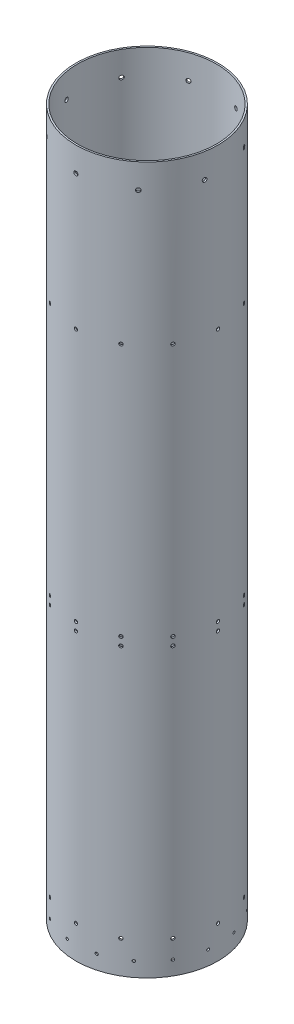
from build123d import *

# Parameters (mm, degrees)
SZKIC1_R                       = 87
SZKIC1_R_2                     = 85
DODANIE_WYCI_GNI_CIE2_DEPTH    = 865
WYTNIJ_WYCI_GNI_CIE1_REACH     = 888.606
SZKIC3_R                       = 2
SZYK_KO_OWY1_COUNT             = 12
SZYK_LINIOWY1_COPY_1_REACH     = 888.606
SZYK_LINIOWY1_COPY_1_SKETCH_R  = 2
SZYK_LINIOWY1_COPY_2_REACH     = 888.606
SZYK_LINIOWY1_COPY_2_SKETCH_R  = 2
SZYK_LINIOWY1_COPY_3_REACH     = 888.606
SZYK_LINIOWY1_COPY_3_SKETCH_R  = 2
SZYK_LINIOWY1_COPY_4_REACH     = 888.606
SZYK_LINIOWY1_COPY_4_SKETCH_R  = 2
SZYK_LINIOWY1_COPY_5_REACH     = 888.606
SZYK_LINIOWY1_COPY_5_SKETCH_R  = 2
SZYK_LINIOWY1_COPY_6_REACH     = 888.606
SZYK_LINIOWY1_COPY_6_SKETCH_R  = 2
SZYK_LINIOWY1_COPY_7_REACH     = 888.606
SZYK_LINIOWY1_COPY_7_SKETCH_R  = 2
SZYK_LINIOWY1_COPY_8_REACH     = 888.606
SZYK_LINIOWY1_COPY_8_SKETCH_R  = 2
SZYK_LINIOWY1_COPY_9_REACH     = 888.606
SZYK_LINIOWY1_COPY_9_SKETCH_R  = 2
SZYK_LINIOWY1_COPY_10_REACH    = 888.606
SZYK_LINIOWY1_COPY_10_SKETCH_R = 2
SZYK_LINIOWY1_COPY_11_REACH    = 888.606
SZYK_LINIOWY1_COPY_11_SKETCH_R = 2
SZYK_LINIOWY1_COPY_12_REACH    = 888.606
SZYK_LINIOWY1_COPY_12_SKETCH_R = 2
SZYK_LINIOWY2_COPY_1_REACH     = 888.606
SZYK_LINIOWY2_COPY_1_SKETCH_R  = 2
SZYK_LINIOWY2_COPY_2_REACH     = 888.606
SZYK_LINIOWY2_COPY_2_SKETCH_R  = 2
SZYK_LINIOWY2_COPY_3_REACH     = 888.606
SZYK_LINIOWY2_COPY_3_SKETCH_R  = 2
SZYK_LINIOWY2_COPY_4_REACH     = 888.606
SZYK_LINIOWY2_COPY_4_SKETCH_R  = 2
SZYK_LINIOWY2_COPY_5_REACH     = 888.606
SZYK_LINIOWY2_COPY_5_SKETCH_R  = 2
SZYK_LINIOWY2_COPY_6_REACH     = 888.606
SZYK_LINIOWY2_COPY_6_SKETCH_R  = 2
SZYK_LINIOWY2_COPY_7_REACH     = 888.606
SZYK_LINIOWY2_COPY_7_SKETCH_R  = 2
SZYK_LINIOWY2_COPY_8_REACH     = 888.606
SZYK_LINIOWY2_COPY_8_SKETCH_R  = 2
SZYK_LINIOWY2_COPY_9_REACH     = 888.606
SZYK_LINIOWY2_COPY_9_SKETCH_R  = 2
SZYK_LINIOWY2_COPY_10_REACH    = 888.606
SZYK_LINIOWY2_COPY_10_SKETCH_R = 2
SZYK_LINIOWY2_COPY_11_REACH    = 888.606
SZYK_LINIOWY2_COPY_11_SKETCH_R = 2
SZYK_LINIOWY2_COPY_12_REACH    = 888.606
SZYK_LINIOWY2_COPY_12_SKETCH_R = 2
SZYK_LINIOWY4_COPY_1_REACH     = 888.606
SZYK_LINIOWY4_COPY_1_SKETCH_R  = 2
SZYK_LINIOWY4_COPY_2_REACH     = 888.606
SZYK_LINIOWY4_COPY_2_SKETCH_R  = 2
SZYK_LINIOWY4_COPY_3_REACH     = 888.606
SZYK_LINIOWY4_COPY_3_SKETCH_R  = 2
SZYK_LINIOWY4_COPY_4_REACH     = 888.606
SZYK_LINIOWY4_COPY_4_SKETCH_R  = 2
SZYK_LINIOWY4_COPY_5_REACH     = 888.606
SZYK_LINIOWY4_COPY_5_SKETCH_R  = 2
SZYK_LINIOWY4_COPY_6_REACH     = 888.606
SZYK_LINIOWY4_COPY_6_SKETCH_R  = 2
SZYK_LINIOWY4_COPY_7_REACH     = 888.606
SZYK_LINIOWY4_COPY_7_SKETCH_R  = 2
SZYK_LINIOWY4_COPY_8_REACH     = 888.606
SZYK_LINIOWY4_COPY_8_SKETCH_R  = 2
SZYK_LINIOWY4_COPY_9_REACH     = 888.606
SZYK_LINIOWY4_COPY_9_SKETCH_R  = 2
SZYK_LINIOWY4_COPY_10_REACH    = 888.606
SZYK_LINIOWY4_COPY_10_SKETCH_R = 2
SZYK_LINIOWY4_COPY_11_REACH    = 888.606
SZYK_LINIOWY4_COPY_11_SKETCH_R = 2
SZYK_LINIOWY4_COPY_12_REACH    = 888.606
SZYK_LINIOWY4_COPY_12_SKETCH_R = 2
SZKIC8_R                       = 2.5
WYTNIJ_WYCI_GNI_CIE6_DEPTH     = 10
SZYK_KO_OWY5_COUNT             = 9
SZKIC11_R                      = 1.6
WYTNIJ_WYCI_GNI_CIE7_DEPTH     = 10
SZYK_KO_OWY6_COUNT             = 16


with BuildPart() as part:
    # Szkic1 → Dodanie-wyciągnięcie2 (new body)
    with BuildSketch(Plane(origin=(0, 0, 0), x_dir=(1, 0, 0), z_dir=(0, 1, 0))):
        Circle(SZKIC1_R)
        Circle(SZKIC1_R_2, mode=Mode.SUBTRACT)
    extrude(amount=DODANIE_WYCI_GNI_CIE2_DEPTH)

    # Szkic3 → Wytnij-wyciągnięcie1 (cut, up to next)
    with BuildSketch(Plane.XY.offset(87), mode=Mode.PRIVATE) as wytnij_wyci_gni_cie1_sk1:
        with Locations((0, 40)):
            Circle(SZKIC3_R)
    wytnij_wyci_gni_cie1_tool1 = extrude(wytnij_wyci_gni_cie1_sk1.sketch, amount=-WYTNIJ_WYCI_GNI_CIE1_REACH, mode=Mode.PRIVATE) & part.part
    wytnij_wyci_gni_cie1 = wytnij_wyci_gni_cie1_tool1.solids().sort_by_distance((0, 40, 87))[0]
    add(wytnij_wyci_gni_cie1, mode=Mode.SUBTRACT)

    # Szyk kołowy1: Wytnij-wyciągnięcie1 ×12 about axis
    szyk_ko_owy1_axis = Axis((0, 865, 0), (0, -1, 0))
    for i in range(1, SZYK_KO_OWY1_COUNT):
        add(wytnij_wyci_gni_cie1.rotate(szyk_ko_owy1_axis, i * 360 / SZYK_KO_OWY1_COUNT), mode=Mode.SUBTRACT)

    # Szyk liniowy1 copy 1 sketch → Szyk liniowy1 copy 1 (cut, up to next)
    with BuildSketch(Plane(origin=(-43.5, 310, 75.344210129), x_dir=(0.8660254037844387, 0, 0.49999999999999994), z_dir=(-0.49999999999999994, 0, 0.8660254037844387)), mode=Mode.PRIVATE) as szyk_liniowy1_copy_1_sk1:
        with Locations((0, 40)):
            Circle(SZYK_LINIOWY1_COPY_1_SKETCH_R)
    szyk_liniowy1_copy_1_tool1 = extrude(szyk_liniowy1_copy_1_sk1.sketch, amount=-SZYK_LINIOWY1_COPY_1_REACH, mode=Mode.PRIVATE) & part.part
    add(szyk_liniowy1_copy_1_tool1.solids().sort_by_distance((-43.5, 350, 75.344210129))[0], mode=Mode.SUBTRACT)

    # Szyk liniowy1 copy 2 sketch → Szyk liniowy1 copy 2 (cut, up to next)
    with BuildSketch(Plane(origin=(-75.344210129, 310, 43.5), x_dir=(0.5000000000000001, 0, 0.8660254037844386), z_dir=(-0.8660254037844386, 0, 0.5000000000000001)), mode=Mode.PRIVATE) as szyk_liniowy1_copy_2_sk1:
        with Locations((0, 40)):
            Circle(SZYK_LINIOWY1_COPY_2_SKETCH_R)
    szyk_liniowy1_copy_2_tool1 = extrude(szyk_liniowy1_copy_2_sk1.sketch, amount=-SZYK_LINIOWY1_COPY_2_REACH, mode=Mode.PRIVATE) & part.part
    add(szyk_liniowy1_copy_2_tool1.solids().sort_by_distance((-75.344210129, 350, 43.5))[0], mode=Mode.SUBTRACT)

    # Szyk liniowy1 copy 3 sketch → Szyk liniowy1 copy 3 (cut, up to next)
    with BuildSketch(Plane(origin=(-87, 310, 0), x_dir=(0, 0, 1), z_dir=(-1, 0, 0)), mode=Mode.PRIVATE) as szyk_liniowy1_copy_3_sk1:
        with Locations((0, 40)):
            Circle(SZYK_LINIOWY1_COPY_3_SKETCH_R)
    szyk_liniowy1_copy_3_tool1 = extrude(szyk_liniowy1_copy_3_sk1.sketch, amount=-SZYK_LINIOWY1_COPY_3_REACH, mode=Mode.PRIVATE) & part.part
    add(szyk_liniowy1_copy_3_tool1.solids().sort_by_distance((-87, 350, 0))[0], mode=Mode.SUBTRACT)

    # Szyk liniowy1 copy 4 sketch → Szyk liniowy1 copy 4 (cut, up to next)
    with BuildSketch(Plane(origin=(-75.344210129, 310, -43.5), x_dir=(-0.4999999999999998, 0, 0.8660254037844387), z_dir=(-0.8660254037844387, 0, -0.4999999999999998)), mode=Mode.PRIVATE) as szyk_liniowy1_copy_4_sk1:
        with Locations((0, 40)):
            Circle(SZYK_LINIOWY1_COPY_4_SKETCH_R)
    szyk_liniowy1_copy_4_tool1 = extrude(szyk_liniowy1_copy_4_sk1.sketch, amount=-SZYK_LINIOWY1_COPY_4_REACH, mode=Mode.PRIVATE) & part.part
    add(szyk_liniowy1_copy_4_tool1.solids().sort_by_distance((-75.344210129, 350, -43.5))[0], mode=Mode.SUBTRACT)

    # Szyk liniowy1 copy 5 sketch → Szyk liniowy1 copy 5 (cut, up to next)
    with BuildSketch(Plane(origin=(-43.5, 310, -75.344210129), x_dir=(-0.8660254037844387, 0, 0.49999999999999994), z_dir=(-0.49999999999999994, 0, -0.8660254037844387)), mode=Mode.PRIVATE) as szyk_liniowy1_copy_5_sk1:
        with Locations((0, 40)):
            Circle(SZYK_LINIOWY1_COPY_5_SKETCH_R)
    szyk_liniowy1_copy_5_tool1 = extrude(szyk_liniowy1_copy_5_sk1.sketch, amount=-SZYK_LINIOWY1_COPY_5_REACH, mode=Mode.PRIVATE) & part.part
    add(szyk_liniowy1_copy_5_tool1.solids().sort_by_distance((-43.5, 350, -75.344210129))[0], mode=Mode.SUBTRACT)

    # Szyk liniowy1 copy 6 sketch → Szyk liniowy1 copy 6 (cut, up to next)
    with BuildSketch(Plane(origin=(0, 310, -87), x_dir=(-1, 0, 0), z_dir=(0, 0, -1)), mode=Mode.PRIVATE) as szyk_liniowy1_copy_6_sk1:
        with Locations((0, 40)):
            Circle(SZYK_LINIOWY1_COPY_6_SKETCH_R)
    szyk_liniowy1_copy_6_tool1 = extrude(szyk_liniowy1_copy_6_sk1.sketch, amount=-SZYK_LINIOWY1_COPY_6_REACH, mode=Mode.PRIVATE) & part.part
    add(szyk_liniowy1_copy_6_tool1.solids().sort_by_distance((0, 350, -87))[0], mode=Mode.SUBTRACT)

    # Szyk liniowy1 copy 7 sketch → Szyk liniowy1 copy 7 (cut, up to next)
    with BuildSketch(Plane(origin=(43.5, 310, -75.344210129), x_dir=(-0.8660254037844386, 0, -0.5000000000000001), z_dir=(0.5000000000000001, 0, -0.8660254037844386)), mode=Mode.PRIVATE) as szyk_liniowy1_copy_7_sk1:
        with Locations((0, 40)):
            Circle(SZYK_LINIOWY1_COPY_7_SKETCH_R)
    szyk_liniowy1_copy_7_tool1 = extrude(szyk_liniowy1_copy_7_sk1.sketch, amount=-SZYK_LINIOWY1_COPY_7_REACH, mode=Mode.PRIVATE) & part.part
    add(szyk_liniowy1_copy_7_tool1.solids().sort_by_distance((43.5, 350, -75.344210129))[0], mode=Mode.SUBTRACT)

    # Szyk liniowy1 copy 8 sketch → Szyk liniowy1 copy 8 (cut, up to next)
    with BuildSketch(Plane(origin=(75.344210129, 310, -43.5), x_dir=(-0.5000000000000004, 0, -0.8660254037844384), z_dir=(0.8660254037844384, 0, -0.5000000000000004)), mode=Mode.PRIVATE) as szyk_liniowy1_copy_8_sk1:
        with Locations((0, 40)):
            Circle(SZYK_LINIOWY1_COPY_8_SKETCH_R)
    szyk_liniowy1_copy_8_tool1 = extrude(szyk_liniowy1_copy_8_sk1.sketch, amount=-SZYK_LINIOWY1_COPY_8_REACH, mode=Mode.PRIVATE) & part.part
    add(szyk_liniowy1_copy_8_tool1.solids().sort_by_distance((75.344210129, 350, -43.5))[0], mode=Mode.SUBTRACT)

    # Szyk liniowy1 copy 9 sketch → Szyk liniowy1 copy 9 (cut, up to next)
    with BuildSketch(Plane(origin=(87, 310, 0), x_dir=(0, 0, -1), z_dir=(1, 0, 0)), mode=Mode.PRIVATE) as szyk_liniowy1_copy_9_sk1:
        with Locations((0, 40)):
            Circle(SZYK_LINIOWY1_COPY_9_SKETCH_R)
    szyk_liniowy1_copy_9_tool1 = extrude(szyk_liniowy1_copy_9_sk1.sketch, amount=-SZYK_LINIOWY1_COPY_9_REACH, mode=Mode.PRIVATE) & part.part
    add(szyk_liniowy1_copy_9_tool1.solids().sort_by_distance((87, 350, 0))[0], mode=Mode.SUBTRACT)

    # Szyk liniowy1 copy 10 sketch → Szyk liniowy1 copy 10 (cut, up to next)
    with BuildSketch(Plane(origin=(75.344210129, 310, 43.5), x_dir=(0.5000000000000001, 0, -0.8660254037844386), z_dir=(0.8660254037844386, 0, 0.5000000000000001)), mode=Mode.PRIVATE) as szyk_liniowy1_copy_10_sk1:
        with Locations((0, 40)):
            Circle(SZYK_LINIOWY1_COPY_10_SKETCH_R)
    szyk_liniowy1_copy_10_tool1 = extrude(szyk_liniowy1_copy_10_sk1.sketch, amount=-SZYK_LINIOWY1_COPY_10_REACH, mode=Mode.PRIVATE) & part.part
    add(szyk_liniowy1_copy_10_tool1.solids().sort_by_distance((75.344210129, 350, 43.5))[0], mode=Mode.SUBTRACT)

    # Szyk liniowy1 copy 11 sketch → Szyk liniowy1 copy 11 (cut, up to next)
    with BuildSketch(Plane(origin=(43.5, 310, 75.344210129), x_dir=(0.8660254037844384, 0, -0.5000000000000004), z_dir=(0.5000000000000004, 0, 0.8660254037844384)), mode=Mode.PRIVATE) as szyk_liniowy1_copy_11_sk1:
        with Locations((0, 40)):
            Circle(SZYK_LINIOWY1_COPY_11_SKETCH_R)
    szyk_liniowy1_copy_11_tool1 = extrude(szyk_liniowy1_copy_11_sk1.sketch, amount=-SZYK_LINIOWY1_COPY_11_REACH, mode=Mode.PRIVATE) & part.part
    add(szyk_liniowy1_copy_11_tool1.solids().sort_by_distance((43.5, 350, 75.344210129))[0], mode=Mode.SUBTRACT)

    # Szyk liniowy1 copy 12 sketch → Szyk liniowy1 copy 12 (cut, up to next)
    with BuildSketch(Plane(origin=(0, 310, 87), x_dir=(1, 0, 0), z_dir=(0, 0, 1)), mode=Mode.PRIVATE) as szyk_liniowy1_copy_12_sk1:
        with Locations((0, 40)):
            Circle(SZYK_LINIOWY1_COPY_12_SKETCH_R)
    szyk_liniowy1_copy_12_tool1 = extrude(szyk_liniowy1_copy_12_sk1.sketch, amount=-SZYK_LINIOWY1_COPY_12_REACH, mode=Mode.PRIVATE) & part.part
    add(szyk_liniowy1_copy_12_tool1.solids().sort_by_distance((0, 350, 87))[0], mode=Mode.SUBTRACT)

    # Szyk liniowy2 copy 1 sketch → Szyk liniowy2 copy 1 (cut, up to next)
    with BuildSketch(Plane(origin=(-43.5, 320, 75.344210129), x_dir=(0.8660254037844387, 0, 0.49999999999999994), z_dir=(-0.49999999999999994, 0, 0.8660254037844387)), mode=Mode.PRIVATE) as szyk_liniowy2_copy_1_sk1:
        with Locations((0, 40)):
            Circle(SZYK_LINIOWY2_COPY_1_SKETCH_R)
    szyk_liniowy2_copy_1_tool1 = extrude(szyk_liniowy2_copy_1_sk1.sketch, amount=-SZYK_LINIOWY2_COPY_1_REACH, mode=Mode.PRIVATE) & part.part
    add(szyk_liniowy2_copy_1_tool1.solids().sort_by_distance((-43.5, 360, 75.344210129))[0], mode=Mode.SUBTRACT)

    # Szyk liniowy2 copy 2 sketch → Szyk liniowy2 copy 2 (cut, up to next)
    with BuildSketch(Plane(origin=(-75.344210129, 320, 43.5), x_dir=(0.5000000000000001, 0, 0.8660254037844386), z_dir=(-0.8660254037844386, 0, 0.5000000000000001)), mode=Mode.PRIVATE) as szyk_liniowy2_copy_2_sk1:
        with Locations((0, 40)):
            Circle(SZYK_LINIOWY2_COPY_2_SKETCH_R)
    szyk_liniowy2_copy_2_tool1 = extrude(szyk_liniowy2_copy_2_sk1.sketch, amount=-SZYK_LINIOWY2_COPY_2_REACH, mode=Mode.PRIVATE) & part.part
    add(szyk_liniowy2_copy_2_tool1.solids().sort_by_distance((-75.344210129, 360, 43.5))[0], mode=Mode.SUBTRACT)

    # Szyk liniowy2 copy 3 sketch → Szyk liniowy2 copy 3 (cut, up to next)
    with BuildSketch(Plane(origin=(-87, 320, 0), x_dir=(0, 0, 1), z_dir=(-1, 0, 0)), mode=Mode.PRIVATE) as szyk_liniowy2_copy_3_sk1:
        with Locations((0, 40)):
            Circle(SZYK_LINIOWY2_COPY_3_SKETCH_R)
    szyk_liniowy2_copy_3_tool1 = extrude(szyk_liniowy2_copy_3_sk1.sketch, amount=-SZYK_LINIOWY2_COPY_3_REACH, mode=Mode.PRIVATE) & part.part
    add(szyk_liniowy2_copy_3_tool1.solids().sort_by_distance((-87, 360, 0))[0], mode=Mode.SUBTRACT)

    # Szyk liniowy2 copy 4 sketch → Szyk liniowy2 copy 4 (cut, up to next)
    with BuildSketch(Plane(origin=(-75.344210129, 320, -43.5), x_dir=(-0.4999999999999998, 0, 0.8660254037844387), z_dir=(-0.8660254037844387, 0, -0.4999999999999998)), mode=Mode.PRIVATE) as szyk_liniowy2_copy_4_sk1:
        with Locations((0, 40)):
            Circle(SZYK_LINIOWY2_COPY_4_SKETCH_R)
    szyk_liniowy2_copy_4_tool1 = extrude(szyk_liniowy2_copy_4_sk1.sketch, amount=-SZYK_LINIOWY2_COPY_4_REACH, mode=Mode.PRIVATE) & part.part
    add(szyk_liniowy2_copy_4_tool1.solids().sort_by_distance((-75.344210129, 360, -43.5))[0], mode=Mode.SUBTRACT)

    # Szyk liniowy2 copy 5 sketch → Szyk liniowy2 copy 5 (cut, up to next)
    with BuildSketch(Plane(origin=(-43.5, 320, -75.344210129), x_dir=(-0.8660254037844387, 0, 0.49999999999999994), z_dir=(-0.49999999999999994, 0, -0.8660254037844387)), mode=Mode.PRIVATE) as szyk_liniowy2_copy_5_sk1:
        with Locations((0, 40)):
            Circle(SZYK_LINIOWY2_COPY_5_SKETCH_R)
    szyk_liniowy2_copy_5_tool1 = extrude(szyk_liniowy2_copy_5_sk1.sketch, amount=-SZYK_LINIOWY2_COPY_5_REACH, mode=Mode.PRIVATE) & part.part
    add(szyk_liniowy2_copy_5_tool1.solids().sort_by_distance((-43.5, 360, -75.344210129))[0], mode=Mode.SUBTRACT)

    # Szyk liniowy2 copy 6 sketch → Szyk liniowy2 copy 6 (cut, up to next)
    with BuildSketch(Plane(origin=(0, 320, -87), x_dir=(-1, 0, 0), z_dir=(0, 0, -1)), mode=Mode.PRIVATE) as szyk_liniowy2_copy_6_sk1:
        with Locations((0, 40)):
            Circle(SZYK_LINIOWY2_COPY_6_SKETCH_R)
    szyk_liniowy2_copy_6_tool1 = extrude(szyk_liniowy2_copy_6_sk1.sketch, amount=-SZYK_LINIOWY2_COPY_6_REACH, mode=Mode.PRIVATE) & part.part
    add(szyk_liniowy2_copy_6_tool1.solids().sort_by_distance((0, 360, -87))[0], mode=Mode.SUBTRACT)

    # Szyk liniowy2 copy 7 sketch → Szyk liniowy2 copy 7 (cut, up to next)
    with BuildSketch(Plane(origin=(43.5, 320, -75.344210129), x_dir=(-0.8660254037844386, 0, -0.5000000000000001), z_dir=(0.5000000000000001, 0, -0.8660254037844386)), mode=Mode.PRIVATE) as szyk_liniowy2_copy_7_sk1:
        with Locations((0, 40)):
            Circle(SZYK_LINIOWY2_COPY_7_SKETCH_R)
    szyk_liniowy2_copy_7_tool1 = extrude(szyk_liniowy2_copy_7_sk1.sketch, amount=-SZYK_LINIOWY2_COPY_7_REACH, mode=Mode.PRIVATE) & part.part
    add(szyk_liniowy2_copy_7_tool1.solids().sort_by_distance((43.5, 360, -75.344210129))[0], mode=Mode.SUBTRACT)

    # Szyk liniowy2 copy 8 sketch → Szyk liniowy2 copy 8 (cut, up to next)
    with BuildSketch(Plane(origin=(75.344210129, 320, -43.5), x_dir=(-0.5000000000000004, 0, -0.8660254037844384), z_dir=(0.8660254037844384, 0, -0.5000000000000004)), mode=Mode.PRIVATE) as szyk_liniowy2_copy_8_sk1:
        with Locations((0, 40)):
            Circle(SZYK_LINIOWY2_COPY_8_SKETCH_R)
    szyk_liniowy2_copy_8_tool1 = extrude(szyk_liniowy2_copy_8_sk1.sketch, amount=-SZYK_LINIOWY2_COPY_8_REACH, mode=Mode.PRIVATE) & part.part
    add(szyk_liniowy2_copy_8_tool1.solids().sort_by_distance((75.344210129, 360, -43.5))[0], mode=Mode.SUBTRACT)

    # Szyk liniowy2 copy 9 sketch → Szyk liniowy2 copy 9 (cut, up to next)
    with BuildSketch(Plane(origin=(87, 320, 0), x_dir=(0, 0, -1), z_dir=(1, 0, 0)), mode=Mode.PRIVATE) as szyk_liniowy2_copy_9_sk1:
        with Locations((0, 40)):
            Circle(SZYK_LINIOWY2_COPY_9_SKETCH_R)
    szyk_liniowy2_copy_9_tool1 = extrude(szyk_liniowy2_copy_9_sk1.sketch, amount=-SZYK_LINIOWY2_COPY_9_REACH, mode=Mode.PRIVATE) & part.part
    add(szyk_liniowy2_copy_9_tool1.solids().sort_by_distance((87, 360, 0))[0], mode=Mode.SUBTRACT)

    # Szyk liniowy2 copy 10 sketch → Szyk liniowy2 copy 10 (cut, up to next)
    with BuildSketch(Plane(origin=(75.344210129, 320, 43.5), x_dir=(0.5000000000000001, 0, -0.8660254037844386), z_dir=(0.8660254037844386, 0, 0.5000000000000001)), mode=Mode.PRIVATE) as szyk_liniowy2_copy_10_sk1:
        with Locations((0, 40)):
            Circle(SZYK_LINIOWY2_COPY_10_SKETCH_R)
    szyk_liniowy2_copy_10_tool1 = extrude(szyk_liniowy2_copy_10_sk1.sketch, amount=-SZYK_LINIOWY2_COPY_10_REACH, mode=Mode.PRIVATE) & part.part
    add(szyk_liniowy2_copy_10_tool1.solids().sort_by_distance((75.344210129, 360, 43.5))[0], mode=Mode.SUBTRACT)

    # Szyk liniowy2 copy 11 sketch → Szyk liniowy2 copy 11 (cut, up to next)
    with BuildSketch(Plane(origin=(43.5, 320, 75.344210129), x_dir=(0.8660254037844384, 0, -0.5000000000000004), z_dir=(0.5000000000000004, 0, 0.8660254037844384)), mode=Mode.PRIVATE) as szyk_liniowy2_copy_11_sk1:
        with Locations((0, 40)):
            Circle(SZYK_LINIOWY2_COPY_11_SKETCH_R)
    szyk_liniowy2_copy_11_tool1 = extrude(szyk_liniowy2_copy_11_sk1.sketch, amount=-SZYK_LINIOWY2_COPY_11_REACH, mode=Mode.PRIVATE) & part.part
    add(szyk_liniowy2_copy_11_tool1.solids().sort_by_distance((43.5, 360, 75.344210129))[0], mode=Mode.SUBTRACT)

    # Szyk liniowy2 copy 12 sketch → Szyk liniowy2 copy 12 (cut, up to next)
    with BuildSketch(Plane(origin=(0, 320, 87), x_dir=(1, 0, 0), z_dir=(0, 0, 1)), mode=Mode.PRIVATE) as szyk_liniowy2_copy_12_sk1:
        with Locations((0, 40)):
            Circle(SZYK_LINIOWY2_COPY_12_SKETCH_R)
    szyk_liniowy2_copy_12_tool1 = extrude(szyk_liniowy2_copy_12_sk1.sketch, amount=-SZYK_LINIOWY2_COPY_12_REACH, mode=Mode.PRIVATE) & part.part
    add(szyk_liniowy2_copy_12_tool1.solids().sort_by_distance((0, 360, 87))[0], mode=Mode.SUBTRACT)

    # Szyk liniowy4 copy 1 sketch → Szyk liniowy4 copy 1 (cut, up to next)
    with BuildSketch(Plane(origin=(-43.5, 630, 75.344210129), x_dir=(0.8660254037844387, 0, 0.49999999999999994), z_dir=(-0.49999999999999994, 0, 0.8660254037844387)), mode=Mode.PRIVATE) as szyk_liniowy4_copy_1_sk1:
        with Locations((0, 40)):
            Circle(SZYK_LINIOWY4_COPY_1_SKETCH_R)
    szyk_liniowy4_copy_1_tool1 = extrude(szyk_liniowy4_copy_1_sk1.sketch, amount=-SZYK_LINIOWY4_COPY_1_REACH, mode=Mode.PRIVATE) & part.part
    add(szyk_liniowy4_copy_1_tool1.solids().sort_by_distance((-43.5, 670, 75.344210129))[0], mode=Mode.SUBTRACT)

    # Szyk liniowy4 copy 2 sketch → Szyk liniowy4 copy 2 (cut, up to next)
    with BuildSketch(Plane(origin=(-75.344210129, 630, 43.5), x_dir=(0.5000000000000001, 0, 0.8660254037844386), z_dir=(-0.8660254037844386, 0, 0.5000000000000001)), mode=Mode.PRIVATE) as szyk_liniowy4_copy_2_sk1:
        with Locations((0, 40)):
            Circle(SZYK_LINIOWY4_COPY_2_SKETCH_R)
    szyk_liniowy4_copy_2_tool1 = extrude(szyk_liniowy4_copy_2_sk1.sketch, amount=-SZYK_LINIOWY4_COPY_2_REACH, mode=Mode.PRIVATE) & part.part
    add(szyk_liniowy4_copy_2_tool1.solids().sort_by_distance((-75.344210129, 670, 43.5))[0], mode=Mode.SUBTRACT)

    # Szyk liniowy4 copy 3 sketch → Szyk liniowy4 copy 3 (cut, up to next)
    with BuildSketch(Plane(origin=(-87, 630, 0), x_dir=(0, 0, 1), z_dir=(-1, 0, 0)), mode=Mode.PRIVATE) as szyk_liniowy4_copy_3_sk1:
        with Locations((0, 40)):
            Circle(SZYK_LINIOWY4_COPY_3_SKETCH_R)
    szyk_liniowy4_copy_3_tool1 = extrude(szyk_liniowy4_copy_3_sk1.sketch, amount=-SZYK_LINIOWY4_COPY_3_REACH, mode=Mode.PRIVATE) & part.part
    add(szyk_liniowy4_copy_3_tool1.solids().sort_by_distance((-87, 670, 0))[0], mode=Mode.SUBTRACT)

    # Szyk liniowy4 copy 4 sketch → Szyk liniowy4 copy 4 (cut, up to next)
    with BuildSketch(Plane(origin=(-75.344210129, 630, -43.5), x_dir=(-0.4999999999999998, 0, 0.8660254037844387), z_dir=(-0.8660254037844387, 0, -0.4999999999999998)), mode=Mode.PRIVATE) as szyk_liniowy4_copy_4_sk1:
        with Locations((0, 40)):
            Circle(SZYK_LINIOWY4_COPY_4_SKETCH_R)
    szyk_liniowy4_copy_4_tool1 = extrude(szyk_liniowy4_copy_4_sk1.sketch, amount=-SZYK_LINIOWY4_COPY_4_REACH, mode=Mode.PRIVATE) & part.part
    add(szyk_liniowy4_copy_4_tool1.solids().sort_by_distance((-75.344210129, 670, -43.5))[0], mode=Mode.SUBTRACT)

    # Szyk liniowy4 copy 5 sketch → Szyk liniowy4 copy 5 (cut, up to next)
    with BuildSketch(Plane(origin=(-43.5, 630, -75.344210129), x_dir=(-0.8660254037844387, 0, 0.49999999999999994), z_dir=(-0.49999999999999994, 0, -0.8660254037844387)), mode=Mode.PRIVATE) as szyk_liniowy4_copy_5_sk1:
        with Locations((0, 40)):
            Circle(SZYK_LINIOWY4_COPY_5_SKETCH_R)
    szyk_liniowy4_copy_5_tool1 = extrude(szyk_liniowy4_copy_5_sk1.sketch, amount=-SZYK_LINIOWY4_COPY_5_REACH, mode=Mode.PRIVATE) & part.part
    add(szyk_liniowy4_copy_5_tool1.solids().sort_by_distance((-43.5, 670, -75.344210129))[0], mode=Mode.SUBTRACT)

    # Szyk liniowy4 copy 6 sketch → Szyk liniowy4 copy 6 (cut, up to next)
    with BuildSketch(Plane(origin=(0, 630, -87), x_dir=(-1, 0, 0), z_dir=(0, 0, -1)), mode=Mode.PRIVATE) as szyk_liniowy4_copy_6_sk1:
        with Locations((0, 40)):
            Circle(SZYK_LINIOWY4_COPY_6_SKETCH_R)
    szyk_liniowy4_copy_6_tool1 = extrude(szyk_liniowy4_copy_6_sk1.sketch, amount=-SZYK_LINIOWY4_COPY_6_REACH, mode=Mode.PRIVATE) & part.part
    add(szyk_liniowy4_copy_6_tool1.solids().sort_by_distance((0, 670, -87))[0], mode=Mode.SUBTRACT)

    # Szyk liniowy4 copy 7 sketch → Szyk liniowy4 copy 7 (cut, up to next)
    with BuildSketch(Plane(origin=(43.5, 630, -75.344210129), x_dir=(-0.8660254037844386, 0, -0.5000000000000001), z_dir=(0.5000000000000001, 0, -0.8660254037844386)), mode=Mode.PRIVATE) as szyk_liniowy4_copy_7_sk1:
        with Locations((0, 40)):
            Circle(SZYK_LINIOWY4_COPY_7_SKETCH_R)
    szyk_liniowy4_copy_7_tool1 = extrude(szyk_liniowy4_copy_7_sk1.sketch, amount=-SZYK_LINIOWY4_COPY_7_REACH, mode=Mode.PRIVATE) & part.part
    add(szyk_liniowy4_copy_7_tool1.solids().sort_by_distance((43.5, 670, -75.344210129))[0], mode=Mode.SUBTRACT)

    # Szyk liniowy4 copy 8 sketch → Szyk liniowy4 copy 8 (cut, up to next)
    with BuildSketch(Plane(origin=(75.344210129, 630, -43.5), x_dir=(-0.5000000000000004, 0, -0.8660254037844384), z_dir=(0.8660254037844384, 0, -0.5000000000000004)), mode=Mode.PRIVATE) as szyk_liniowy4_copy_8_sk1:
        with Locations((0, 40)):
            Circle(SZYK_LINIOWY4_COPY_8_SKETCH_R)
    szyk_liniowy4_copy_8_tool1 = extrude(szyk_liniowy4_copy_8_sk1.sketch, amount=-SZYK_LINIOWY4_COPY_8_REACH, mode=Mode.PRIVATE) & part.part
    add(szyk_liniowy4_copy_8_tool1.solids().sort_by_distance((75.344210129, 670, -43.5))[0], mode=Mode.SUBTRACT)

    # Szyk liniowy4 copy 9 sketch → Szyk liniowy4 copy 9 (cut, up to next)
    with BuildSketch(Plane(origin=(87, 630, 0), x_dir=(0, 0, -1), z_dir=(1, 0, 0)), mode=Mode.PRIVATE) as szyk_liniowy4_copy_9_sk1:
        with Locations((0, 40)):
            Circle(SZYK_LINIOWY4_COPY_9_SKETCH_R)
    szyk_liniowy4_copy_9_tool1 = extrude(szyk_liniowy4_copy_9_sk1.sketch, amount=-SZYK_LINIOWY4_COPY_9_REACH, mode=Mode.PRIVATE) & part.part
    add(szyk_liniowy4_copy_9_tool1.solids().sort_by_distance((87, 670, 0))[0], mode=Mode.SUBTRACT)

    # Szyk liniowy4 copy 10 sketch → Szyk liniowy4 copy 10 (cut, up to next)
    with BuildSketch(Plane(origin=(75.344210129, 630, 43.5), x_dir=(0.5000000000000001, 0, -0.8660254037844386), z_dir=(0.8660254037844386, 0, 0.5000000000000001)), mode=Mode.PRIVATE) as szyk_liniowy4_copy_10_sk1:
        with Locations((0, 40)):
            Circle(SZYK_LINIOWY4_COPY_10_SKETCH_R)
    szyk_liniowy4_copy_10_tool1 = extrude(szyk_liniowy4_copy_10_sk1.sketch, amount=-SZYK_LINIOWY4_COPY_10_REACH, mode=Mode.PRIVATE) & part.part
    add(szyk_liniowy4_copy_10_tool1.solids().sort_by_distance((75.344210129, 670, 43.5))[0], mode=Mode.SUBTRACT)

    # Szyk liniowy4 copy 11 sketch → Szyk liniowy4 copy 11 (cut, up to next)
    with BuildSketch(Plane(origin=(43.5, 630, 75.344210129), x_dir=(0.8660254037844384, 0, -0.5000000000000004), z_dir=(0.5000000000000004, 0, 0.8660254037844384)), mode=Mode.PRIVATE) as szyk_liniowy4_copy_11_sk1:
        with Locations((0, 40)):
            Circle(SZYK_LINIOWY4_COPY_11_SKETCH_R)
    szyk_liniowy4_copy_11_tool1 = extrude(szyk_liniowy4_copy_11_sk1.sketch, amount=-SZYK_LINIOWY4_COPY_11_REACH, mode=Mode.PRIVATE) & part.part
    add(szyk_liniowy4_copy_11_tool1.solids().sort_by_distance((43.5, 670, 75.344210129))[0], mode=Mode.SUBTRACT)

    # Szyk liniowy4 copy 12 sketch → Szyk liniowy4 copy 12 (cut, up to next)
    with BuildSketch(Plane(origin=(0, 630, 87), x_dir=(1, 0, 0), z_dir=(0, 0, 1)), mode=Mode.PRIVATE) as szyk_liniowy4_copy_12_sk1:
        with Locations((0, 40)):
            Circle(SZYK_LINIOWY4_COPY_12_SKETCH_R)
    szyk_liniowy4_copy_12_tool1 = extrude(szyk_liniowy4_copy_12_sk1.sketch, amount=-SZYK_LINIOWY4_COPY_12_REACH, mode=Mode.PRIVATE) & part.part
    add(szyk_liniowy4_copy_12_tool1.solids().sort_by_distance((0, 670, 87))[0], mode=Mode.SUBTRACT)

    # Szkic8 → Wytnij-wyciągnięcie6 (cut)
    with BuildSketch(Plane.XY.offset(87)):
        with Locations((0, 835)):
            Circle(SZKIC8_R)
    wytnij_wyci_gni_cie6 = extrude(amount=-WYTNIJ_WYCI_GNI_CIE6_DEPTH, mode=Mode.SUBTRACT)

    # Szyk kołowy5: Wytnij-wyciągnięcie6 ×9 about axis
    szyk_ko_owy5_axis = Axis((0, 865, 0), (0, -1, 0))
    for i in range(1, SZYK_KO_OWY5_COUNT):
        add(wytnij_wyci_gni_cie6.rotate(szyk_ko_owy5_axis, i * 360 / SZYK_KO_OWY5_COUNT), mode=Mode.SUBTRACT)

    # Szkic11 → Wytnij-wyciągnięcie7 (cut)
    with BuildSketch(Plane(origin=(22.517256924, 0, 84.035546887), x_dir=(0.9659258262890701, 0, -0.25881904510251413), z_dir=(0.25881904510251413, 0, 0.9659258262890701))):
        with Locations((0, 17.5)):
            Circle(SZKIC11_R)
    wytnij_wyci_gni_cie7 = extrude(amount=-WYTNIJ_WYCI_GNI_CIE7_DEPTH, mode=Mode.SUBTRACT)

    # Szyk kołowy6: Wytnij-wyciągnięcie7 ×16 about axis
    szyk_ko_owy6_axis = Axis((0, 865, 0), (0, -1, 0))
    for i in range(1, SZYK_KO_OWY6_COUNT):
        add(wytnij_wyci_gni_cie7.rotate(szyk_ko_owy6_axis, i * 360 / SZYK_KO_OWY6_COUNT), mode=Mode.SUBTRACT)


solid = part.part
